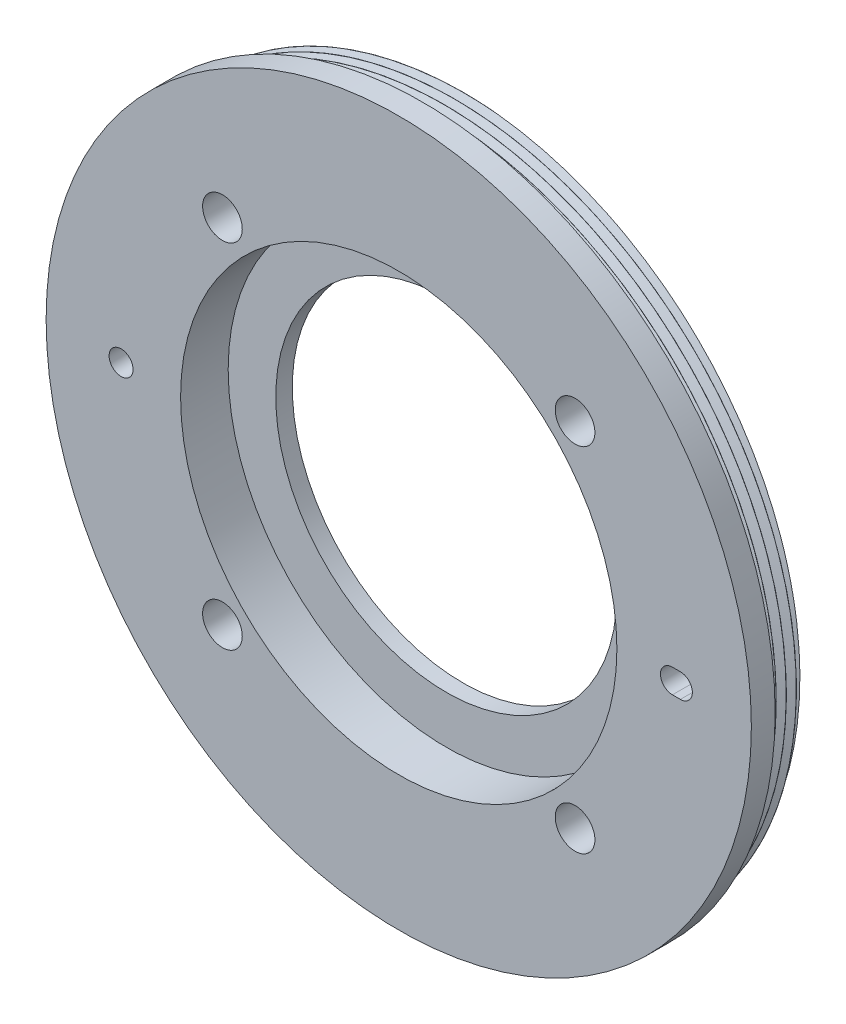
from build123d import *
from build123d.topology import SkipClean

# Parameters (mm, degrees)
SKETCH1_R          = 43
EXTRUDE1_DEPTH     = 5.08
SKETCH2_R          = 44.45
EXTRUDE2_DEPTH     = 3
SKETCH5_R          = 2.5
EXTRUDE4_DEPTH     = 64.378950764
CUT_SWEEP1_PITCH   = 1.27
SKETCH15_R         = 1.51
EXTRUDE10_DEPTH    = 9.525
SKETCH16_R         = 27.5
CUT_EXTRUDE1_DEPTH = 6
SKETCH17_R         = 21.5
CUT_EXTRUDE2_DEPTH = 2.08


with BuildPart() as part:
    # Sketch1 → Extrude1 (new body)
    with BuildSketch(Plane.XY):
        Circle(SKETCH1_R)
    extrude(amount=EXTRUDE1_DEPTH)

    # Sketch2 → Extrude2 (add)
    with BuildSketch(Plane.XY.offset(5.08)):
        Circle(SKETCH2_R)
    extrude(amount=EXTRUDE2_DEPTH)

    # Sketch5 → Extrude4 (cut, through all)
    with BuildSketch(Plane.XY.offset(8.08)):
        with Locations((-22.225, 22.225)):
            Circle(SKETCH5_R)
        with Locations((22.225, 22.225)):
            Circle(SKETCH5_R)
        with Locations((22.225, -22.225)):
            Circle(SKETCH5_R)
        with Locations((-22.225, -22.225)):
            Circle(SKETCH5_R)
    extrude(amount=-EXTRUDE4_DEPTH, mode=Mode.SUBTRACT)

    # Cut-Sweep1: the profile of Sketch10 profile screwed along a right-hand helix of 4 turns, 8 arcs to a turn; built about Z, then put on its axis
    with SkipClean():  # the faces are left unmerged after this step: merging them gives an invalid solid
        cut_sweep1_z = Axis((0, 0, 0), (0, 0, 1))
        cut_sweep1_corners = [(43.0003, 0, -0.625173205), (41.917468245, 0, 0), (43.0003, 0, 0.625173205)]
        with BuildLine(mode=Mode.PRIVATE) as cut_sweep1_profile:
            Line(cut_sweep1_corners[0], cut_sweep1_corners[1])
            Line(cut_sweep1_corners[1], cut_sweep1_corners[2])
            Line(cut_sweep1_corners[2], cut_sweep1_corners[0])
        cut_sweep1_cap = Face(cut_sweep1_profile.wire())
        cut_sweep1_turn_angles = [0, 22.5, 45, 67.5, 90, 112.5, 135, 157.5, 180, 202.5, 225, 247.5, 270, 292.5, 315, 337.5, 360]
        cut_sweep1_turn_weights = [1, 0.9238795325112867, 1, 0.9238795325112867, 1, 0.9238795325112867, 1, 0.9238795325112867, 1, 0.9238795325112867, 1, 0.9238795325112867, 1, 0.9238795325112867, 1, 0.9238795325112867, 1]
        cut_sweep1_turn_rails = [Edge.make_bspline([Vector(p[0], p[1], 0).rotate(cut_sweep1_z, cut_sweep1_turn_angles[k]) / cut_sweep1_turn_weights[k] + Vector(0, 0, p[2] + CUT_SWEEP1_PITCH * cut_sweep1_turn_angles[k] / 360) for k in range(17)], [0, 0, 0, 1, 1, 2, 2, 3, 3, 4, 4, 5, 5, 6, 6, 7, 7, 8, 8, 8], 2, cut_sweep1_turn_weights) for p in cut_sweep1_corners]
        cut_sweep1_turn_sides = [Face.make_surface_from_curves(cut_sweep1_turn_rails[p[0]], cut_sweep1_turn_rails[p[1]]) for p in [(0, 1), (1, 2), (2, 0)]]
        cut_sweep1 = Plane(origin=(0, 0, 4.455), x_dir=(0, 1, 0), z_dir=(0, 0, -1)) * Solid(Shell([*[p.moved(Location((0, 0, CUT_SWEEP1_PITCH * i))) for i in range(4) for p in cut_sweep1_turn_sides], cut_sweep1_cap, cut_sweep1_cap.rotate(cut_sweep1_z, 1440).moved(Location((0, 0, CUT_SWEEP1_PITCH * 1440 / 360)))]))
        add(cut_sweep1, mode=Mode.SUBTRACT)

    # Sketch15 → Extrude10 (cut)
    with SkipClean():  # the faces are left unmerged after this step: merging them gives an invalid solid
        with BuildSketch(Plane(origin=(0, 0, 0), x_dir=(-1, 0, 0), z_dir=(0, 0, -1))):
            with Locations((35, 0)):
                Circle(SKETCH15_R)
            with BuildLine():
                Line((-35.5, 1.51), (-34.5, 1.51))
                ThreePointArc((-34.5, 1.51), (-32.99, 0), (-34.5, -1.51))
                Line((-34.5, -1.51), (-35.5, -1.51))
                ThreePointArc((-35.5, -1.51), (-37.01, 0), (-35.5, 1.51))
            make_face()
        extrude(amount=-EXTRUDE10_DEPTH, mode=Mode.SUBTRACT)

    # Sketch16 → Cut-Extrude1 (cut)
    with SkipClean():  # the faces are left unmerged after this step: merging them gives an invalid solid
        with BuildSketch(Plane.XY.offset(8.08)):
            Circle(SKETCH16_R)
        extrude(amount=-CUT_EXTRUDE1_DEPTH, mode=Mode.SUBTRACT)

    # Sketch17 → Cut-Extrude2 (cut)
    with SkipClean():  # the faces are left unmerged after this step: merging them gives an invalid solid
        with BuildSketch(Plane.XY.offset(2.08)):
            Circle(SKETCH17_R)
        extrude(amount=-CUT_EXTRUDE2_DEPTH, mode=Mode.SUBTRACT)


solid = part.part
